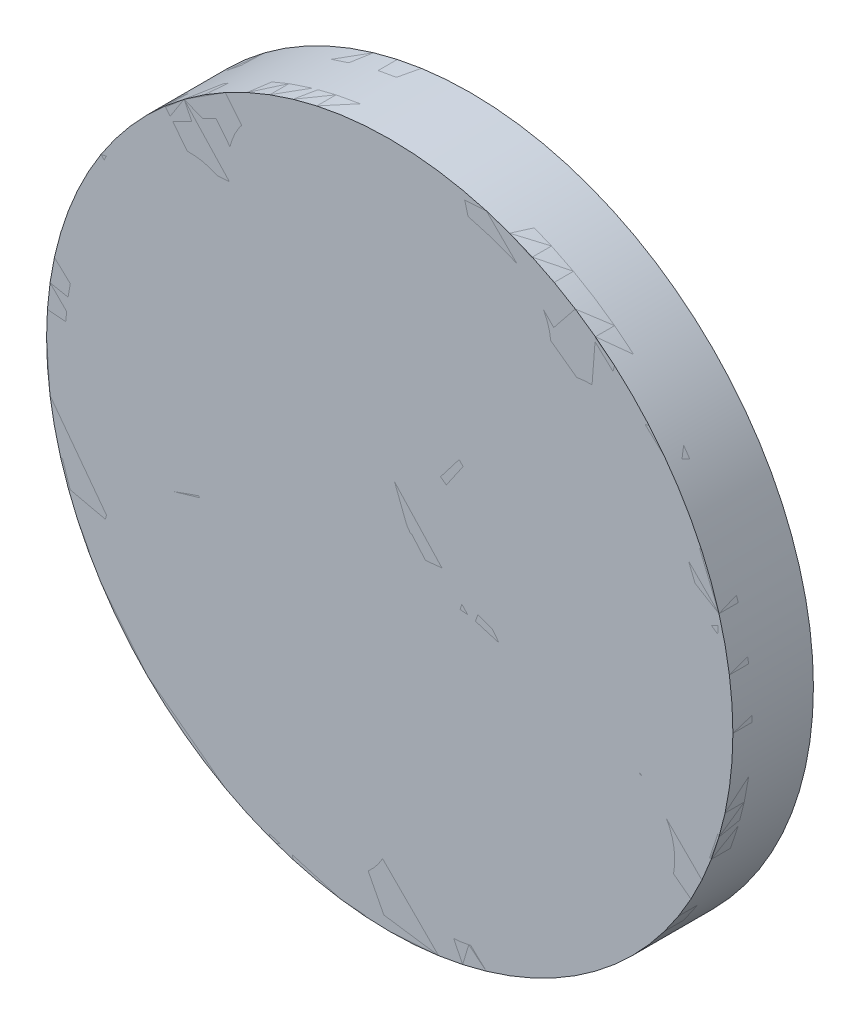
from build123d import *

# Parameters (mm, degrees)
SKETCH1_R               = 23.8125
BOSS_EXTRUDE1_DEPTH     = 2.794
SKETCH1_4_R             = 23.8125
BOSS_EXTRUDE2_DEPTH     = 2.794
CUT_EXTRUDE3_DEPTH      = 34.79166685
CIRPATTERN2_COUNT       = 5
FILLET2_R               = 1.905
CUT_EXTRUDE4_DEPTH      = 35.136432995
CUT_EXTRUDE4_DEPTH_BACK = 35.136432995


with BuildPart() as part:
    # Sketch1 → Boss-Extrude1 (new, symmetric)
    with BuildSketch(Plane.XY):
        Circle(SKETCH1_R)
    extrude(amount=BOSS_EXTRUDE1_DEPTH, both=True)


with BuildPart() as body_2:
    # Sketch1<4> → Boss-Extrude2 (new, symmetric)
    with BuildSketch(Plane.XY):
        Circle(SKETCH1_4_R)
    extrude(amount=BOSS_EXTRUDE2_DEPTH, both=True)

    # Sketch1<5> → Cut-Extrude3 (cut, symmetric)
    with BuildSketch(Plane.XY):
        with BuildLine():
            Line((-2.015117484, 6.436152235), (-8.772387015, 15.242397338))
            ThreePointArc((-8.772387015, 15.242397338), (-9.207387491, 17.458369203), (-7.705658236, 19.144953314))
            ThreePointArc((-7.705658236, 19.144953314), (0, 20.6375), (7.705658236, 19.144953314))
            ThreePointArc((7.705658236, 19.144953314), (9.207387491, 17.458369203), (8.772387015, 15.242397338))
            Line((8.772387015, 15.242397338), (2.015117484, 6.436152235))
            ThreePointArc((2.015117484, 6.436152235), (0, 5.442406265), (-2.015117484, 6.436152235))
        make_face()
    cut_extrude3 = extrude(amount=CUT_EXTRUDE3_DEPTH, both=True, mode=Mode.SUBTRACT)

    # CirPattern2: Cut-Extrude3 ×5 about axis
    cirpattern2_axis = Axis((0, 0, 0), (0, 0, 1))
    for i in range(1, CIRPATTERN2_COUNT):
        add(cut_extrude3.rotate(cirpattern2_axis, i * 360 / CIRPATTERN2_COUNT), mode=Mode.SUBTRACT)

    # Fillet2
    # the kernel refuses this fillet: 1.905 mm, written as the material it takes off along each edge
    with BuildSketch(Plane(origin=(0, 7.982406265, -2.794), x_dir=(-0.7933533402912346, -0.6087614290087213, 0), z_dir=(-0.6087614290087213, 0.7933533402912346, 0))) as fillet2_piece_1:
        with BuildLine():
            CenterArc((2.54 + FILLET2_R, FILLET2_R), FILLET2_R, 180, 90)
            Line((2.54, FILLET2_R), (2.54, 0))
            Line((2.54, 0), (2.54 + FILLET2_R, 0))
        make_face()
    revolve(axis=Axis((0, 7.982406265, -2.794), (0, 0, 1)), revolution_arc=105, mode=Mode.SUBTRACT)
    with BuildSketch(Plane(origin=(-2.015117484, 6.436152235, 2.794), x_dir=(-0.7933533402912345, -0.6087614290087215, 0), z_dir=(-0.6087614290087217, 0.7933533402912345, 0)), Plane(origin=(8.772387015, 15.242397338, 2.794), x_dir=(0.7933533402912339, -0.6087614290087222, 0), z_dir=(-0.6087614290087223, -0.7933533402912339, 0)), Plane(origin=(-6.743850071, 0.072389804, 2.794), x_dir=(0.33380685923377207, -0.942641491092178, 0), z_dir=(-0.942641491092178, -0.33380685923377207, 0)), Plane(origin=(-11.785564643, 13.053195646, 2.794), x_dir=(0.8241261886220168, 0.566406236924831, 0), z_dir=(0.5664062369248312, -0.8241261886220168, 0)), Plane(origin=(-2.152811075, -6.391412875, 2.794), x_dir=(0.9996573249755573, 0.02617694830787431, 0), z_dir=(0.026176948307874315, -0.9996573249755574, 0)), Plane(origin=(-16.056266541, -7.175078767, 2.794), x_dir=(-0.2840153447039206, 0.9588197348681936, 0), z_dir=(0.9588197348681937, 0.2840153447039206, 0)), Plane(origin=(5.413339656, -4.022500197, 2.794), x_dir=(0.2840153447039215, 0.9588197348681934, 0), z_dir=(0.9588197348681935, -0.2840153447039216, 0)), Plane(origin=(1.862246189, -17.487638196, 2.794), x_dir=(-0.9996573249755571, 0.02617694830787531, 0), z_dir=(0.026176948307875314, 0.9996573249755573, 0)), Plane(origin=(5.498438974, 3.905371034, 2.794), x_dir=(-0.8241261886220163, 0.566406236924832, 0), z_dir=(0.566406236924832, 0.8241261886220163, 0)), Plane(origin=(17.207197981, -3.632876021, 2.794), x_dir=(-0.33380685923377307, -0.9426414910921777, 0), z_dir=(-0.9426414910921777, 0.33380685923377307, 0))) as fillet2_piece_2:
        with BuildLine():
            CenterArc((FILLET2_R, -FILLET2_R), FILLET2_R, 90, 90)
            Line((0, -FILLET2_R), (0, 0))
            Line((0, 0), (FILLET2_R, 0))
        make_face()
    extrude(amount=11.100029023, mode=Mode.SUBTRACT)
    with BuildSketch(Plane(origin=(-6.75726953, 16.788651368, 2.794), x_dir=(-0.3733813803215466, 0.9276779316277696, 0), z_dir=(0.9276779316277696, 0.3733813803215466, 0))) as fillet2_piece_3:
        with BuildLine():
            CenterArc((2.54 + FILLET2_R, -FILLET2_R), FILLET2_R, 90, 90)
            Line((2.54, -FILLET2_R), (2.54, 0))
            Line((2.54, 0), (2.54 + FILLET2_R, 0))
        make_face()
    revolve(axis=Axis((-6.75726953, 16.788651368, 2.794), (0, 0, 1)), revolution_arc=105.575692464, mode=Mode.SUBTRACT)
    with BuildSketch(Plane(origin=(0, 0, 2.794), x_dir=(0.37338138032154905, 0.9276779316277683, 0), z_dir=(0.9276779316277683, -0.37338138032154905, 0))) as fillet2_piece_4:
        with BuildLine():
            CenterArc((20.6375 + FILLET2_R, -FILLET2_R), FILLET2_R, 90, 90)
            Line((20.6375, -FILLET2_R), (20.6375, 0))
            Line((20.6375, 0), (20.6375 + FILLET2_R, 0))
        make_face()
    revolve(axis=Axis((0, 0, 2.794), (0, 0, 1)), revolution_arc=43.848615073, mode=Mode.SUBTRACT)
    with BuildSketch(Plane(origin=(6.75726953, 16.788651368, -2.794), x_dir=(0.7933533402912323, -0.6087614290087244, 0), z_dir=(-0.6087614290087244, -0.7933533402912323, 0))) as fillet2_piece_5:
        with BuildLine():
            CenterArc((2.54 + FILLET2_R, FILLET2_R), FILLET2_R, 180, 90)
            Line((2.54, FILLET2_R), (2.54, 0))
            Line((2.54, 0), (2.54 + FILLET2_R, 0))
        make_face()
    revolve(axis=Axis((6.75726953, 16.788651368, -2.794), (0, 0, 1)), revolution_arc=105.575692464, mode=Mode.SUBTRACT)
    with BuildSketch(Plane(origin=(8.772387015, 15.242397338, -2.794), x_dir=(0.7933533402912339, -0.6087614290087222, 0), z_dir=(-0.6087614290087223, -0.7933533402912339, 0)), Plane(origin=(-2.015117484, 6.436152235, -2.794), x_dir=(-0.7933533402912345, -0.6087614290087215, 0), z_dir=(-0.6087614290087217, 0.7933533402912345, 0)), Plane(origin=(-11.785564643, 13.053195646, -2.794), x_dir=(0.8241261886220168, 0.566406236924831, 0), z_dir=(0.5664062369248312, -0.8241261886220168, 0)), Plane(origin=(-6.743850071, 0.072389804, -2.794), x_dir=(0.33380685923377207, -0.942641491092178, 0), z_dir=(-0.942641491092178, -0.33380685923377207, 0)), Plane(origin=(-16.056266541, -7.175078767, -2.794), x_dir=(-0.2840153447039206, 0.9588197348681936, 0), z_dir=(0.9588197348681937, 0.2840153447039206, 0)), Plane(origin=(-2.152811075, -6.391412875, -2.794), x_dir=(0.9996573249755573, 0.02617694830787431, 0), z_dir=(0.026176948307874315, -0.9996573249755574, 0)), Plane(origin=(1.862246189, -17.487638196, -2.794), x_dir=(-0.9996573249755571, 0.02617694830787531, 0), z_dir=(0.026176948307875314, 0.9996573249755573, 0)), Plane(origin=(5.413339656, -4.022500197, -2.794), x_dir=(0.2840153447039215, 0.9588197348681934, 0), z_dir=(0.9588197348681935, -0.2840153447039216, 0)), Plane(origin=(17.207197981, -3.632876021, -2.794), x_dir=(-0.33380685923377307, -0.9426414910921777, 0), z_dir=(-0.9426414910921777, 0.33380685923377307, 0)), Plane(origin=(5.498438974, 3.905371034, -2.794), x_dir=(-0.8241261886220163, 0.566406236924832, 0), z_dir=(0.566406236924832, 0.8241261886220163, 0))) as fillet2_piece_6:
        with BuildLine():
            CenterArc((FILLET2_R, FILLET2_R), FILLET2_R, 180, 90)
            Line((0, FILLET2_R), (0, 0))
            Line((0, 0), (FILLET2_R, 0))
        make_face()
    extrude(amount=11.100029023, mode=Mode.SUBTRACT)
    with BuildSketch(Plane(origin=(-6.75726953, 16.788651368, -2.794), x_dir=(-0.3733813803215466, 0.9276779316277696, 0), z_dir=(0.9276779316277696, 0.3733813803215466, 0))) as fillet2_piece_7:
        with BuildLine():
            CenterArc((2.54 + FILLET2_R, FILLET2_R), FILLET2_R, 180, 90)
            Line((2.54, FILLET2_R), (2.54, 0))
            Line((2.54, 0), (2.54 + FILLET2_R, 0))
        make_face()
    revolve(axis=Axis((-6.75726953, 16.788651368, -2.794), (0, 0, 1)), revolution_arc=105.575692464, mode=Mode.SUBTRACT)
    with BuildSketch(Plane(origin=(0, 0, -2.794), x_dir=(0.37338138032154905, 0.9276779316277683, 0), z_dir=(0.9276779316277683, -0.37338138032154905, 0))) as fillet2_piece_8:
        with BuildLine():
            CenterArc((20.6375 + FILLET2_R, FILLET2_R), FILLET2_R, 180, 90)
            Line((20.6375, FILLET2_R), (20.6375, 0))
            Line((20.6375, 0), (20.6375 + FILLET2_R, 0))
        make_face()
    revolve(axis=Axis((0, 0, -2.794), (0, 0, 1)), revolution_arc=43.848615073, mode=Mode.SUBTRACT)
    with BuildSketch(Plane(origin=(0, 7.982406265, 2.794), x_dir=(-0.7933533402912346, -0.6087614290087213, 0), z_dir=(-0.6087614290087213, 0.7933533402912346, 0))) as fillet2_piece_9:
        with BuildLine():
            CenterArc((2.54 + FILLET2_R, -FILLET2_R), FILLET2_R, 90, 90)
            Line((2.54, -FILLET2_R), (2.54, 0))
            Line((2.54, 0), (2.54 + FILLET2_R, 0))
        make_face()
    revolve(axis=Axis((0, 7.982406265, 2.794), (0, 0, 1)), revolution_arc=105, mode=Mode.SUBTRACT)
    with BuildSketch(Plane(origin=(6.75726953, 16.788651368, 2.794), x_dir=(0.7933533402912323, -0.6087614290087244, 0), z_dir=(-0.6087614290087244, -0.7933533402912323, 0))) as fillet2_piece_10:
        with BuildLine():
            CenterArc((2.54 + FILLET2_R, -FILLET2_R), FILLET2_R, 90, 90)
            Line((2.54, -FILLET2_R), (2.54, 0))
            Line((2.54, 0), (2.54 + FILLET2_R, 0))
        make_face()
    revolve(axis=Axis((6.75726953, 16.788651368, 2.794), (0, 0, 1)), revolution_arc=105.575692464, mode=Mode.SUBTRACT)
    with BuildSketch(Plane(origin=(-7.591719494, 2.466699192, -2.794), x_dir=(0.33380685923377257, -0.9426414910921779, 0), z_dir=(-0.9426414910921779, -0.33380685923377257, 0))) as fillet2_piece_11:
        with BuildLine():
            CenterArc((2.54 + FILLET2_R, FILLET2_R), FILLET2_R, 180, 90)
            Line((2.54, FILLET2_R), (2.54, 0))
            Line((2.54, 0), (2.54 + FILLET2_R, 0))
        make_face()
    revolve(axis=Axis((-7.591719494, 2.466699192, -2.794), (0, 0, 1)), revolution_arc=105, mode=Mode.SUBTRACT)
    with BuildSketch(Plane(origin=(-18.055067403, -1.238566634, 2.794), x_dir=(-0.9976553338003336, -0.06843854863850468, 0), z_dir=(-0.06843854863850468, 0.9976553338003336, 0))) as fillet2_piece_12:
        with BuildLine():
            CenterArc((2.54 + FILLET2_R, -FILLET2_R), FILLET2_R, 90, 90)
            Line((2.54, -FILLET2_R), (2.54, 0))
            Line((2.54, 0), (2.54 + FILLET2_R, 0))
        make_face()
    revolve(axis=Axis((-18.055067403, -1.238566634, 2.794), (0, 0, 1)), revolution_arc=105.575692464, mode=Mode.SUBTRACT)
    with BuildSketch(Plane(origin=(0, 0, 2.794), x_dir=(-0.7668929499952648, 0.6417750409976692, 0), z_dir=(0.6417750409976692, 0.7668929499952648, 0))) as fillet2_piece_13:
        with BuildLine():
            CenterArc((20.6375 + FILLET2_R, -FILLET2_R), FILLET2_R, 90, 90)
            Line((20.6375, -FILLET2_R), (20.6375, 0))
            Line((20.6375, 0), (20.6375 + FILLET2_R, 0))
        make_face()
    revolve(axis=Axis((0, 0, 2.794), (0, 0, 1)), revolution_arc=43.848615073, mode=Mode.SUBTRACT)
    with BuildSketch(Plane(origin=(-13.878845163, 11.614523804, -2.794), x_dir=(0.8241261886220181, 0.5664062369248292, 0), z_dir=(0.5664062369248292, -0.8241261886220181, 0))) as fillet2_piece_14:
        with BuildLine():
            CenterArc((2.54 + FILLET2_R, FILLET2_R), FILLET2_R, 180, 90)
            Line((2.54, FILLET2_R), (2.54, 0))
            Line((2.54, 0), (2.54 + FILLET2_R, 0))
        make_face()
    revolve(axis=Axis((-13.878845163, 11.614523804, -2.794), (0, 0, 1)), revolution_arc=105.575692464, mode=Mode.SUBTRACT)
    with BuildSketch(Plane(origin=(-18.055067403, -1.238566634, -2.794), x_dir=(-0.9976553338003336, -0.06843854863850468, 0), z_dir=(-0.06843854863850468, 0.9976553338003336, 0))) as fillet2_piece_15:
        with BuildLine():
            CenterArc((2.54 + FILLET2_R, FILLET2_R), FILLET2_R, 180, 90)
            Line((2.54, FILLET2_R), (2.54, 0))
            Line((2.54, 0), (2.54 + FILLET2_R, 0))
        make_face()
    revolve(axis=Axis((-18.055067403, -1.238566634, -2.794), (0, 0, 1)), revolution_arc=105.575692464, mode=Mode.SUBTRACT)
    with BuildSketch(Plane(origin=(0, 0, -2.794), x_dir=(-0.7668929499952648, 0.6417750409976692, 0), z_dir=(0.6417750409976692, 0.7668929499952648, 0))) as fillet2_piece_16:
        with BuildLine():
            CenterArc((20.6375 + FILLET2_R, FILLET2_R), FILLET2_R, 180, 90)
            Line((20.6375, FILLET2_R), (20.6375, 0))
            Line((20.6375, 0), (20.6375 + FILLET2_R, 0))
        make_face()
    revolve(axis=Axis((0, 0, -2.794), (0, 0, 1)), revolution_arc=43.848615073, mode=Mode.SUBTRACT)
    with BuildSketch(Plane(origin=(-7.591719494, 2.466699192, 2.794), x_dir=(0.33380685923377257, -0.9426414910921779, 0), z_dir=(-0.9426414910921779, -0.33380685923377257, 0))) as fillet2_piece_17:
        with BuildLine():
            CenterArc((2.54 + FILLET2_R, -FILLET2_R), FILLET2_R, 90, 90)
            Line((2.54, -FILLET2_R), (2.54, 0))
            Line((2.54, 0), (2.54 + FILLET2_R, 0))
        make_face()
    revolve(axis=Axis((-7.591719494, 2.466699192, 2.794), (0, 0, 1)), revolution_arc=105, mode=Mode.SUBTRACT)
    with BuildSketch(Plane(origin=(-13.878845163, 11.614523804, 2.794), x_dir=(0.8241261886220181, 0.5664062369248292, 0), z_dir=(0.5664062369248292, -0.8241261886220181, 0))) as fillet2_piece_18:
        with BuildLine():
            CenterArc((2.54 + FILLET2_R, -FILLET2_R), FILLET2_R, 90, 90)
            Line((2.54, -FILLET2_R), (2.54, 0))
            Line((2.54, 0), (2.54 + FILLET2_R, 0))
        make_face()
    revolve(axis=Axis((-13.878845163, 11.614523804, 2.794), (0, 0, 1)), revolution_arc=105.575692464, mode=Mode.SUBTRACT)
    with BuildSketch(Plane(origin=(-4.69194068, -6.457902324, -2.794), x_dir=(0.9996573249755571, 0.026176948307874953, 0), z_dir=(0.026176948307874953, -0.9996573249755571, 0))) as fillet2_piece_19:
        with BuildLine():
            CenterArc((2.54 + FILLET2_R, FILLET2_R), FILLET2_R, 180, 90)
            Line((2.54, FILLET2_R), (2.54, 0))
            Line((2.54, 0), (2.54 + FILLET2_R, 0))
        make_face()
    revolve(axis=Axis((-4.69194068, -6.457902324, -2.794), (0, 0, 1)), revolution_arc=105, mode=Mode.SUBTRACT)
    with BuildSketch(Plane(origin=(-4.401375794, -17.554127645, 2.794), x_dir=(-0.24320352502468148, -0.9699752808270781, 0), z_dir=(-0.9699752808270781, 0.24320352502468148, 0))) as fillet2_piece_20:
        with BuildLine():
            CenterArc((2.54 + FILLET2_R, -FILLET2_R), FILLET2_R, 90, 90)
            Line((2.54, -FILLET2_R), (2.54, 0))
            Line((2.54, 0), (2.54 + FILLET2_R, 0))
        make_face()
    revolve(axis=Axis((-4.401375794, -17.554127645, 2.794), (0, 0, 1)), revolution_arc=105.575692464, mode=Mode.SUBTRACT)
    with BuildSketch(Plane(origin=(0, 0, 2.794), x_dir=(-0.8473472891512964, -0.5310391431598515, 0), z_dir=(-0.5310391431598515, 0.8473472891512964, 0))) as fillet2_piece_21:
        with BuildLine():
            CenterArc((20.6375 + FILLET2_R, -FILLET2_R), FILLET2_R, 90, 90)
            Line((20.6375, -FILLET2_R), (20.6375, 0))
            Line((20.6375, 0), (20.6375 + FILLET2_R, 0))
        make_face()
    revolve(axis=Axis((0, 0, 2.794), (0, 0, 1)), revolution_arc=43.848615073, mode=Mode.SUBTRACT)
    with BuildSketch(Plane(origin=(-15.334867565, -9.610480893, -2.794), x_dir=(-0.28401534470391854, 0.9588197348681943, 0), z_dir=(0.9588197348681943, 0.28401534470391854, 0))) as fillet2_piece_22:
        with BuildLine():
            CenterArc((2.54 + FILLET2_R, FILLET2_R), FILLET2_R, 180, 90)
            Line((2.54, FILLET2_R), (2.54, 0))
            Line((2.54, 0), (2.54 + FILLET2_R, 0))
        make_face()
    revolve(axis=Axis((-15.334867565, -9.610480893, -2.794), (0, 0, 1)), revolution_arc=105.575692464, mode=Mode.SUBTRACT)
    with BuildSketch(Plane(origin=(-4.401375794, -17.554127645, -2.794), x_dir=(-0.24320352502468148, -0.9699752808270781, 0), z_dir=(-0.9699752808270781, 0.24320352502468148, 0))) as fillet2_piece_23:
        with BuildLine():
            CenterArc((2.54 + FILLET2_R, FILLET2_R), FILLET2_R, 180, 90)
            Line((2.54, FILLET2_R), (2.54, 0))
            Line((2.54, 0), (2.54 + FILLET2_R, 0))
        make_face()
    revolve(axis=Axis((-4.401375794, -17.554127645, -2.794), (0, 0, 1)), revolution_arc=105.575692464, mode=Mode.SUBTRACT)
    with BuildSketch(Plane(origin=(0, 0, -2.794), x_dir=(-0.8473472891512964, -0.5310391431598515, 0), z_dir=(-0.5310391431598515, 0.8473472891512964, 0))) as fillet2_piece_24:
        with BuildLine():
            CenterArc((20.6375 + FILLET2_R, FILLET2_R), FILLET2_R, 180, 90)
            Line((20.6375, FILLET2_R), (20.6375, 0))
            Line((20.6375, 0), (20.6375 + FILLET2_R, 0))
        make_face()
    revolve(axis=Axis((0, 0, -2.794), (0, 0, 1)), revolution_arc=43.848615073, mode=Mode.SUBTRACT)
    with BuildSketch(Plane(origin=(-4.69194068, -6.457902324, 2.794), x_dir=(0.9996573249755571, 0.026176948307874953, 0), z_dir=(0.026176948307874953, -0.9996573249755571, 0))) as fillet2_piece_25:
        with BuildLine():
            CenterArc((2.54 + FILLET2_R, -FILLET2_R), FILLET2_R, 90, 90)
            Line((2.54, -FILLET2_R), (2.54, 0))
            Line((2.54, 0), (2.54 + FILLET2_R, 0))
        make_face()
    revolve(axis=Axis((-4.69194068, -6.457902324, 2.794), (0, 0, 1)), revolution_arc=105, mode=Mode.SUBTRACT)
    with BuildSketch(Plane(origin=(-15.334867565, -9.610480893, 2.794), x_dir=(-0.28401534470391854, 0.9588197348681943, 0), z_dir=(0.9588197348681943, 0.28401534470391854, 0))) as fillet2_piece_26:
        with BuildLine():
            CenterArc((2.54 + FILLET2_R, -FILLET2_R), FILLET2_R, 90, 90)
            Line((2.54, -FILLET2_R), (2.54, 0))
            Line((2.54, 0), (2.54 + FILLET2_R, 0))
        make_face()
    revolve(axis=Axis((-15.334867565, -9.610480893, 2.794), (0, 0, 1)), revolution_arc=105.575692464, mode=Mode.SUBTRACT)
    with BuildSketch(Plane(origin=(4.69194068, -6.457902324, -2.794), x_dir=(0.2840153447039211, 0.9588197348681935, 0), z_dir=(0.9588197348681935, -0.2840153447039211, 0))) as fillet2_piece_27:
        with BuildLine():
            CenterArc((2.54 + FILLET2_R, FILLET2_R), FILLET2_R, 180, 90)
            Line((2.54, FILLET2_R), (2.54, 0))
            Line((2.54, 0), (2.54 + FILLET2_R, 0))
        make_face()
    revolve(axis=Axis((4.69194068, -6.457902324, -2.794), (0, 0, 1)), revolution_arc=105, mode=Mode.SUBTRACT)
    with BuildSketch(Plane(origin=(15.334867565, -9.610480893, 2.794), x_dir=(0.8473472891512954, -0.5310391431598531, 0), z_dir=(-0.5310391431598531, -0.8473472891512954, 0))) as fillet2_piece_28:
        with BuildLine():
            CenterArc((2.54 + FILLET2_R, -FILLET2_R), FILLET2_R, 90, 90)
            Line((2.54, -FILLET2_R), (2.54, 0))
            Line((2.54, 0), (2.54 + FILLET2_R, 0))
        make_face()
    revolve(axis=Axis((15.334867565, -9.610480893, 2.794), (0, 0, 1)), revolution_arc=105.575692464, mode=Mode.SUBTRACT)
    with BuildSketch(Plane(origin=(0, 0, 2.794), x_dir=(0.2432035250246787, -0.9699752808270788, 0), z_dir=(-0.9699752808270788, -0.2432035250246787, 0))) as fillet2_piece_29:
        with BuildLine():
            CenterArc((20.6375 + FILLET2_R, -FILLET2_R), FILLET2_R, 90, 90)
            Line((20.6375, -FILLET2_R), (20.6375, 0))
            Line((20.6375, 0), (20.6375 + FILLET2_R, 0))
        make_face()
    revolve(axis=Axis((0, 0, 2.794), (0, 0, 1)), revolution_arc=43.848615073, mode=Mode.SUBTRACT)
    with BuildSketch(Plane(origin=(4.401375794, -17.554127645, -2.794), x_dir=(-0.9996573249755571, 0.026176948307878513, 0), z_dir=(0.026176948307878513, 0.9996573249755571, 0))) as fillet2_piece_30:
        with BuildLine():
            CenterArc((2.54 + FILLET2_R, FILLET2_R), FILLET2_R, 180, 90)
            Line((2.54, FILLET2_R), (2.54, 0))
            Line((2.54, 0), (2.54 + FILLET2_R, 0))
        make_face()
    revolve(axis=Axis((4.401375794, -17.554127645, -2.794), (0, 0, 1)), revolution_arc=105.575692464, mode=Mode.SUBTRACT)
    with BuildSketch(Plane(origin=(15.334867565, -9.610480893, -2.794), x_dir=(0.8473472891512954, -0.5310391431598531, 0), z_dir=(-0.5310391431598531, -0.8473472891512954, 0))) as fillet2_piece_31:
        with BuildLine():
            CenterArc((2.54 + FILLET2_R, FILLET2_R), FILLET2_R, 180, 90)
            Line((2.54, FILLET2_R), (2.54, 0))
            Line((2.54, 0), (2.54 + FILLET2_R, 0))
        make_face()
    revolve(axis=Axis((15.334867565, -9.610480893, -2.794), (0, 0, 1)), revolution_arc=105.575692464, mode=Mode.SUBTRACT)
    with BuildSketch(Plane(origin=(0, 0, -2.794), x_dir=(0.2432035250246787, -0.9699752808270788, 0), z_dir=(-0.9699752808270788, -0.2432035250246787, 0))) as fillet2_piece_32:
        with BuildLine():
            CenterArc((20.6375 + FILLET2_R, FILLET2_R), FILLET2_R, 180, 90)
            Line((20.6375, FILLET2_R), (20.6375, 0))
            Line((20.6375, 0), (20.6375 + FILLET2_R, 0))
        make_face()
    revolve(axis=Axis((0, 0, -2.794), (0, 0, 1)), revolution_arc=43.848615073, mode=Mode.SUBTRACT)
    with BuildSketch(Plane(origin=(4.69194068, -6.457902324, 2.794), x_dir=(0.2840153447039211, 0.9588197348681935, 0), z_dir=(0.9588197348681935, -0.2840153447039211, 0))) as fillet2_piece_33:
        with BuildLine():
            CenterArc((2.54 + FILLET2_R, -FILLET2_R), FILLET2_R, 90, 90)
            Line((2.54, -FILLET2_R), (2.54, 0))
            Line((2.54, 0), (2.54 + FILLET2_R, 0))
        make_face()
    revolve(axis=Axis((4.69194068, -6.457902324, 2.794), (0, 0, 1)), revolution_arc=105, mode=Mode.SUBTRACT)
    with BuildSketch(Plane(origin=(4.401375794, -17.554127645, 2.794), x_dir=(-0.9996573249755571, 0.026176948307878513, 0), z_dir=(0.026176948307878513, 0.9996573249755571, 0))) as fillet2_piece_34:
        with BuildLine():
            CenterArc((2.54 + FILLET2_R, -FILLET2_R), FILLET2_R, 90, 90)
            Line((2.54, -FILLET2_R), (2.54, 0))
            Line((2.54, 0), (2.54 + FILLET2_R, 0))
        make_face()
    revolve(axis=Axis((4.401375794, -17.554127645, 2.794), (0, 0, 1)), revolution_arc=105.575692464, mode=Mode.SUBTRACT)
    with BuildSketch(Plane(origin=(7.591719494, 2.466699192, -2.794), x_dir=(-0.8241261886220166, 0.5664062369248317, 0), z_dir=(0.5664062369248317, 0.8241261886220166, 0))) as fillet2_piece_35:
        with BuildLine():
            CenterArc((2.54 + FILLET2_R, FILLET2_R), FILLET2_R, 180, 90)
            Line((2.54, FILLET2_R), (2.54, 0))
            Line((2.54, 0), (2.54 + FILLET2_R, 0))
        make_face()
    revolve(axis=Axis((7.591719494, 2.466699192, -2.794), (0, 0, 1)), revolution_arc=105, mode=Mode.SUBTRACT)
    with BuildSketch(Plane(origin=(13.878845163, 11.614523804, 2.794), x_dir=(0.7668929499952666, 0.6417750409976674, 0), z_dir=(0.6417750409976674, -0.7668929499952666, 0))) as fillet2_piece_36:
        with BuildLine():
            CenterArc((2.54 + FILLET2_R, -FILLET2_R), FILLET2_R, 90, 90)
            Line((2.54, -FILLET2_R), (2.54, 0))
            Line((2.54, 0), (2.54 + FILLET2_R, 0))
        make_face()
    revolve(axis=Axis((13.878845163, 11.614523804, 2.794), (0, 0, 1)), revolution_arc=105.575692464, mode=Mode.SUBTRACT)
    with BuildSketch(Plane(origin=(0, 0, 2.794), x_dir=(0.9976553338003333, -0.06843854863850746, 0), z_dir=(-0.06843854863850746, -0.9976553338003333, 0))) as fillet2_piece_37:
        with BuildLine():
            CenterArc((20.6375 + FILLET2_R, -FILLET2_R), FILLET2_R, 90, 90)
            Line((20.6375, -FILLET2_R), (20.6375, 0))
            Line((20.6375, 0), (20.6375 + FILLET2_R, 0))
        make_face()
    revolve(axis=Axis((0, 0, 2.794), (0, 0, 1)), revolution_arc=43.848615073, mode=Mode.SUBTRACT)
    with BuildSketch(Plane(origin=(18.055067403, -1.238566634, -2.794), x_dir=(-0.333806859233776, -0.9426414910921765, 0), z_dir=(-0.9426414910921765, 0.333806859233776, 0))) as fillet2_piece_38:
        with BuildLine():
            CenterArc((2.54 + FILLET2_R, FILLET2_R), FILLET2_R, 180, 90)
            Line((2.54, FILLET2_R), (2.54, 0))
            Line((2.54, 0), (2.54 + FILLET2_R, 0))
        make_face()
    revolve(axis=Axis((18.055067403, -1.238566634, -2.794), (0, 0, 1)), revolution_arc=105.575692464, mode=Mode.SUBTRACT)
    with BuildSketch(Plane(origin=(13.878845163, 11.614523804, -2.794), x_dir=(0.7668929499952666, 0.6417750409976674, 0), z_dir=(0.6417750409976674, -0.7668929499952666, 0))) as fillet2_piece_39:
        with BuildLine():
            CenterArc((2.54 + FILLET2_R, FILLET2_R), FILLET2_R, 180, 90)
            Line((2.54, FILLET2_R), (2.54, 0))
            Line((2.54, 0), (2.54 + FILLET2_R, 0))
        make_face()
    revolve(axis=Axis((13.878845163, 11.614523804, -2.794), (0, 0, 1)), revolution_arc=105.575692464, mode=Mode.SUBTRACT)
    with BuildSketch(Plane(origin=(0, 0, -2.794), x_dir=(0.9976553338003333, -0.06843854863850746, 0), z_dir=(-0.06843854863850746, -0.9976553338003333, 0))) as fillet2_piece_40:
        with BuildLine():
            CenterArc((20.6375 + FILLET2_R, FILLET2_R), FILLET2_R, 180, 90)
            Line((20.6375, FILLET2_R), (20.6375, 0))
            Line((20.6375, 0), (20.6375 + FILLET2_R, 0))
        make_face()
    revolve(axis=Axis((0, 0, -2.794), (0, 0, 1)), revolution_arc=43.848615073, mode=Mode.SUBTRACT)
    with BuildSketch(Plane(origin=(7.591719494, 2.466699192, 2.794), x_dir=(-0.8241261886220166, 0.5664062369248317, 0), z_dir=(0.5664062369248317, 0.8241261886220166, 0))) as fillet2_piece_41:
        with BuildLine():
            CenterArc((2.54 + FILLET2_R, -FILLET2_R), FILLET2_R, 90, 90)
            Line((2.54, -FILLET2_R), (2.54, 0))
            Line((2.54, 0), (2.54 + FILLET2_R, 0))
        make_face()
    revolve(axis=Axis((7.591719494, 2.466699192, 2.794), (0, 0, 1)), revolution_arc=105, mode=Mode.SUBTRACT)
    with BuildSketch(Plane(origin=(18.055067403, -1.238566634, 2.794), x_dir=(-0.333806859233776, -0.9426414910921765, 0), z_dir=(-0.9426414910921765, 0.333806859233776, 0))) as fillet2_piece_42:
        with BuildLine():
            CenterArc((2.54 + FILLET2_R, -FILLET2_R), FILLET2_R, 90, 90)
            Line((2.54, -FILLET2_R), (2.54, 0))
            Line((2.54, 0), (2.54 + FILLET2_R, 0))
        make_face()
    revolve(axis=Axis((18.055067403, -1.238566634, 2.794), (0, 0, 1)), revolution_arc=105.575692464, mode=Mode.SUBTRACT)

    # Sketch2 → Cut-Extrude4 (cut, two sides: drawn at the far end of the back side and taken through both)
    with BuildSketch(Plane.XY.offset(2.794).offset(-CUT_EXTRUDE4_DEPTH_BACK)):
        with BuildLine():
            Line((-1.197914855, 1.14375), (1.197914855, 1.14375))
            ThreePointArc((1.197914855, 1.14375), (0, -1.65625), (-1.197914855, 1.14375))
        make_face()
    extrude(amount=CUT_EXTRUDE4_DEPTH + CUT_EXTRUDE4_DEPTH_BACK, mode=Mode.SUBTRACT)

    # Cut-Sweep2: sweep along a path in Sketch7
    with BuildLine(Plane.XY) as cut_sweep2_path:
        CenterArc((0, 0), 23.8125, 0, 360)
    # Sketch3 → Cut-Sweep2 (sweep, cut)
    with BuildSketch(Plane(origin=(0, 0, 0), x_dir=(0, 0, -1), z_dir=(1, 0, 0))):
        with BuildLine():
            Line((1.4605, 26.2255), (1.4605, 23.8125))
            ThreePointArc((1.4605, 23.8125), (0, 22.352), (-1.4605, 23.8125))
            Line((-1.4605, 23.8125), (-1.4605, 26.2255))
            Line((-1.4605, 26.2255), (1.4605, 26.2255))
        make_face()
    sweep(path=cut_sweep2_path.line, mode=Mode.SUBTRACT)


solid = Compound([part.part, body_2.part])
